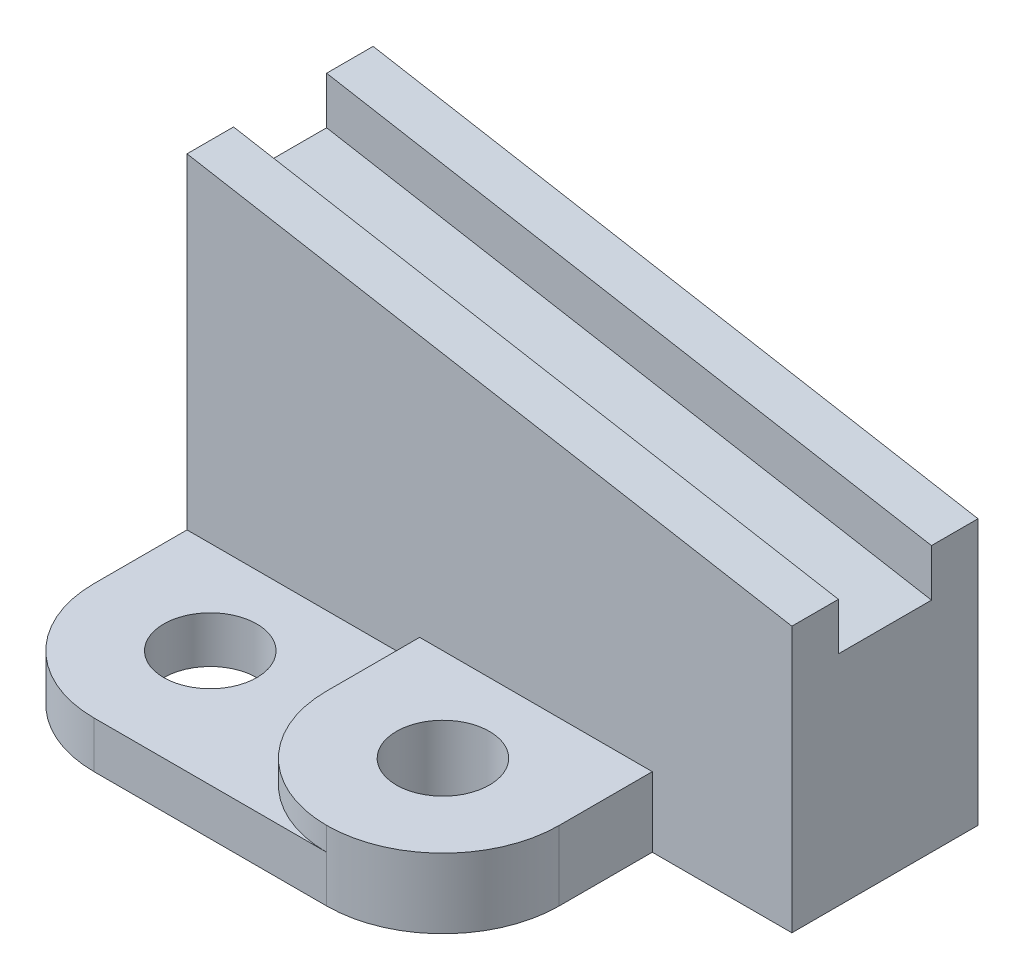
from build123d import *

# Parameters (mm, degrees)
RESSALTO_EXTRUS_O1_DEPTH = 40
ESBO_O4_W                = 171.630568717
ESBO_O4_H                = 20
CORTE_EXTRUS_O3_DEPTH    = 10
ESBO_O5_W                = 100
ESBO_O5_H                = 15
RESSALTO_EXTRUS_O2_DEPTH = 45
ESBO_O6_R                = 10
CORTE_EXTRUS_O6_DEPTH    = 132.657158163
FILETE8_R                = 25
FILETE7_R                = 25
ESBO_O9_W                = 50
ESBO_O9_H                = 45
CORTE_EXTRUS_O7_DEPTH    = 5
FILETE9_R                = 25


with BuildPart() as part:
    # Esboço1 → Ressalto-extrusão1 (new body)
    with BuildSketch(Plane.XY):
        Polygon((-53.29532416, 9.300830565), (76.70467584, 9.300830565), (76.70467584, 66.378323073), (-53.29532416, 89.300830565), align=None)
    extrude(amount=RESSALTO_EXTRUS_O1_DEPTH)

    # Esboço4 → Corte-extrusão3 (cut)
    with BuildSketch(Plane(origin=(13.664290772, 77.494043834, 0), x_dir=(0.9848077530122075, -0.17364817766693377, 0), z_dir=(0.1736481776669338, 0.9848077530122076, 0))):
        with Locations((8.431345703, -20)):
            Rectangle(ESBO_O4_W, ESBO_O4_H)
    extrude(amount=-CORTE_EXTRUS_O3_DEPTH, mode=Mode.SUBTRACT)

    # Esboço5 → Ressalto-extrusão2 (add)
    with BuildSketch(Plane.XY.offset(40)):
        with Locations((-3.29532416, 16.800830565)):
            Rectangle(ESBO_O5_W, ESBO_O5_H)
    extrude(amount=RESSALTO_EXTRUS_O2_DEPTH)

    # Esboço6 → Corte-extrusão6 (cut, through all)
    with BuildSketch(Plane(origin=(0, 24.300830565, 0), x_dir=(1, 0, 0), z_dir=(0, 1, 0))):
        with Locations(Location((-28.29532416, -60, 0), (0, 0, 270))):
            Circle(ESBO_O6_R)
        with Locations(Location((21.70467584, -60, 0), (0, 0, 270))):
            Circle(ESBO_O6_R)
    extrude(amount=-CORTE_EXTRUS_O6_DEPTH, mode=Mode.SUBTRACT)

    # Filete8
    filete8_edges = [part.edges().sort_by_distance(p)[0] for p in [
        (46.70467584, 16.800830565, 85),
    ]]
    fillet(filete8_edges, radius=FILETE8_R)

    # Filete7
    filete7_edges = [part.edges().sort_by_distance(p)[0] for p in [
        (-53.29532416, 16.800830565, 85),
    ]]
    fillet(filete7_edges, radius=FILETE7_R)

    # Esboço9 → Corte-extrusão7 (cut)
    with BuildSketch(Plane(origin=(0, 24.300830565, 0), x_dir=(1, 0, 0), z_dir=(0, 1, 0))):
        with Locations((-28.29532416, -62.5)):
            Rectangle(ESBO_O9_W, ESBO_O9_H)
    extrude(amount=-CORTE_EXTRUS_O7_DEPTH, mode=Mode.SUBTRACT)

    # Filete9
    filete9_edges = [part.edges().sort_by_distance(p)[0] for p in [
        (-3.29532416, 21.800830565, 85),
    ]]
    fillet(filete9_edges, radius=FILETE9_R - 0.0001)  # a hair under: the kernel refuses the full size


solid = part.part
